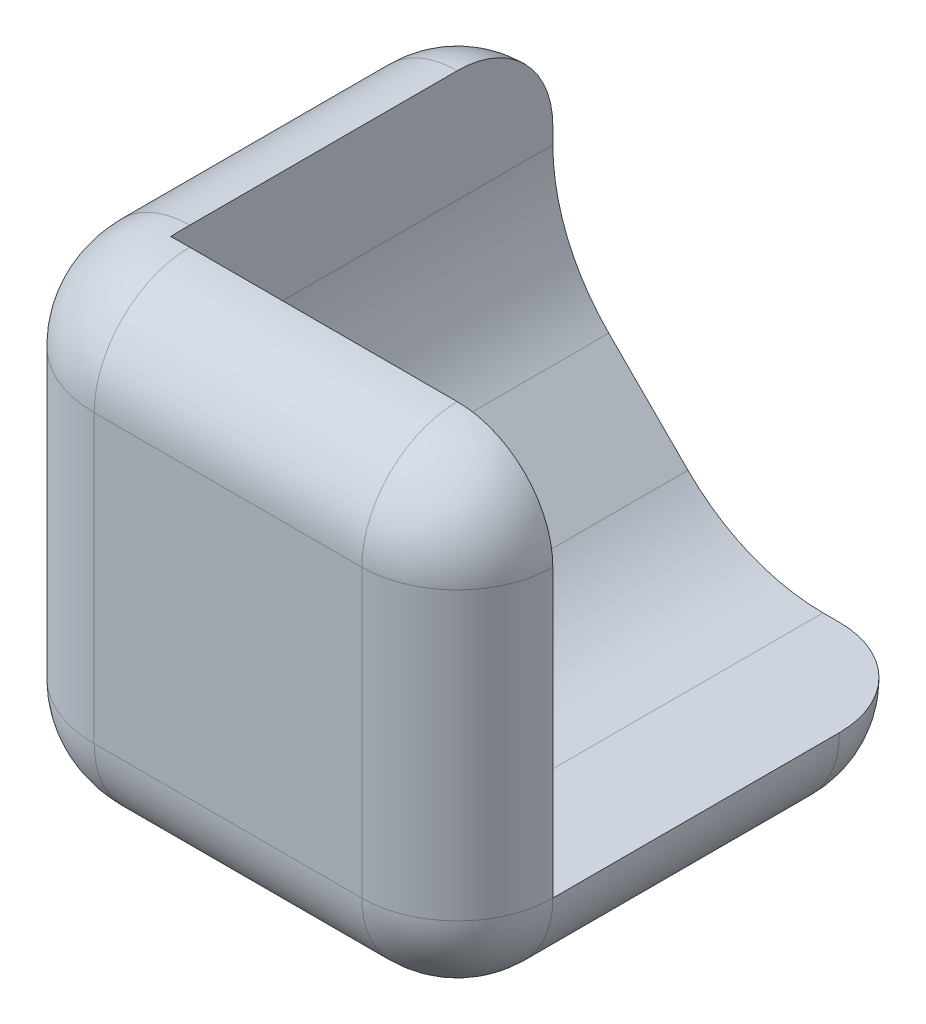
from build123d import *

# Parameters (mm, degrees)
SKETCH1_W           = 10
SKETCH1_H           = 10
BOSS_EXTRUDE1_DEPTH = 20
SKETCH2_W           = 20
SKETCH2_H           = 20
CUT_EXTRUDE1_DEPTH  = 10
BOSS_EXTRUDE2_DEPTH = 10
CUT_EXTRUDE2_DEPTH  = 25
SKETCH5_W           = 12.5
SKETCH5_H           = 7.5
CUT_EXTRUDE3_DEPTH  = 25
FILLET6_R           = 3
FILLET7_R           = 2.5
FILLET8_R           = 2.5
FILLET9_R           = 2.5
FILLET10_R          = 2.5


# Some blends are built 0.0001 mm under size
with BuildPart() as part:
    # Sketch1 → Boss-Extrude1 (new body)
    with BuildSketch(Plane(origin=(0, 0, 0), x_dir=(1, 0, 0), z_dir=(0, 1, 0))):
        Polygon((0, 10), (-10, 10), (-10, -10), (10, -10), (10, 0), (0, 0), align=None)
        with Locations((5, 5)):
            Rectangle(SKETCH1_W, SKETCH1_H)
    extrude(amount=BOSS_EXTRUDE1_DEPTH)

    # Sketch2 → Cut-Extrude1 (cut)
    with BuildSketch(Plane(origin=(0, 20, 0), x_dir=(1, 0, 0), z_dir=(0, 1, 0))):
        with Locations((10, 10)):
            Rectangle(SKETCH2_W, SKETCH2_H)
    extrude(amount=-CUT_EXTRUDE1_DEPTH, mode=Mode.SUBTRACT)

    # Sketch3 → Boss-Extrude2 (add)
    with BuildSketch(Plane(origin=(0, 0, 0), x_dir=(-1, 0, 0), z_dir=(0, 0, -1))):
        with BuildLine():
            Line((-1.464466094, 13.535533906), (-3.535533906, 11.464466094))
            ThreePointArc((-3.535533906, 11.464466094), (-5.15765065, 10.380602337), (-7.071067812, 10))
            Line((-7.071067812, 10), (0, 10))
            Line((0, 10), (0, 17.071067812))
            ThreePointArc((0, 17.071067812), (-0.380602337, 15.15765065), (-1.464466094, 13.535533906))
        make_face()
    extrude(amount=BOSS_EXTRUDE2_DEPTH)

    # Sketch4 → Cut-Extrude2 (cut)
    with BuildSketch(Plane(origin=(0, 20, 0), x_dir=(1, 0, 0), z_dir=(0, 1, 0))):
        Polygon((-2.5, -2.5), (-2.5, 10), (-10, 10), (-10, -10), (10, -10), (10, -2.5), align=None)
    extrude(amount=-CUT_EXTRUDE2_DEPTH, mode=Mode.SUBTRACT)

    # Sketch5 → Cut-Extrude3 (cut)
    with BuildSketch(Plane(origin=(10, 0, 0), x_dir=(0, 0, -1), z_dir=(1, 0, 0))):
        with Locations((3.75, 3.75)):
            Rectangle(SKETCH5_W, SKETCH5_H)
    extrude(amount=-CUT_EXTRUDE3_DEPTH, mode=Mode.SUBTRACT)

    # Fillet6
    fillet6_edges = [part.edges().sort_by_distance(p)[0] for p in [
        (-2.5, 13.75, 2.5),
    ]]
    fillet(fillet6_edges, radius=FILLET6_R)

    # Fillet7
    # the kernel refuses this fillet: 2.5 mm, written as the material it takes off along each edge
    with BuildSketch(Plane(origin=(16.25, 20, 2.5), x_dir=(0, 0, -1), z_dir=(-1, 0, 0)), Plane(origin=(-2.5, 20, -0.5), x_dir=(1, 0, 0), z_dir=(0, 0, -1))) as fillet7_piece_1:
        with BuildLine():
            CenterArc((FILLET7_R, FILLET7_R), FILLET7_R, 180, 90)
            Line((0, FILLET7_R), (0, 0))
            Line((0, 0), (FILLET7_R, 0))
        make_face()
    extrude(amount=15.75, mode=Mode.SUBTRACT)
    with BuildSketch(Plane(origin=(0.5, 20, -0.5), x_dir=(-1, 0, 0), z_dir=(0, 0, -1))) as fillet7_piece_2:
        with BuildLine():
            CenterArc((3 - FILLET7_R, -FILLET7_R), FILLET7_R, 0, 90)
            Line((3, -FILLET7_R), (3, 0))
            Line((3, 0), (3 - FILLET7_R, 0))
        make_face()
    revolve(axis=Axis((0.5, 20, -0.5), (0, 1, 0)), revolution_arc=90, mode=Mode.SUBTRACT)

    # Fillet8
    fillet8_edges = [part.edges().sort_by_distance(p)[0] for p in [
        (-2.5, 7.5, -5.25),
        (5.25, 7.5, 2.5),
        (-1.621320344, 7.5, 1.621320344),
    ]]
    fillet(fillet8_edges, radius=FILLET8_R)

    # Fillet9
    fillet9_edges = [part.edges().sort_by_distance(p)[0] for p in [
        (5, 7.5, -10),
        (-1.767766953, 19.267766953, -10),
        (-2.5, 13.75, -10),
        (10, 19.267766953, 1.767766953),
        (10, 13.75, 2.5),
        (10, 7.5, -5),
        (-1.767766953, 8.232233047, -10),
        (10, 8.232233047, 1.767766953),
    ]]
    fillet(fillet9_edges, radius=FILLET9_R - 0.0001)  # a hair under: the kernel refuses the full size

    # Fillet10
    # the kernel refuses this fillet: 2.5 mm, written as the material it takes off along each edge
    with BuildSketch(Plane(origin=(7.5, 7.5, -7.5), x_dir=(0, 0, -1), z_dir=(-1, 0, 0))) as fillet10_piece_1:
        with BuildLine():
            CenterArc((0.0001, -2.4999), 2.4999, 0, 90)
            Line((2.5, -2.4999), (2.5, 0))
            Line((2.5, 0), (0.0001, 0))
        make_face()
    revolve(axis=Axis((7.5, 7.5, -7.5), (0, -1, 0)), revolution_arc=90, mode=Mode.SUBTRACT)
    with BuildSketch(Plane(origin=(10, 7.5, -10), x_dir=(-1, 0, 0), z_dir=(0, 1, 0))) as fillet10_piece_2:
        with BuildLine():
            CenterArc((FILLET10_R, FILLET10_R), FILLET10_R, 180, 90)
            Line((0, FILLET10_R), (0, 0))
            Line((0, 0), (FILLET10_R, 0))
        make_face()
    extrude(amount=8.75, mode=Mode.SUBTRACT)


solid = part.part
